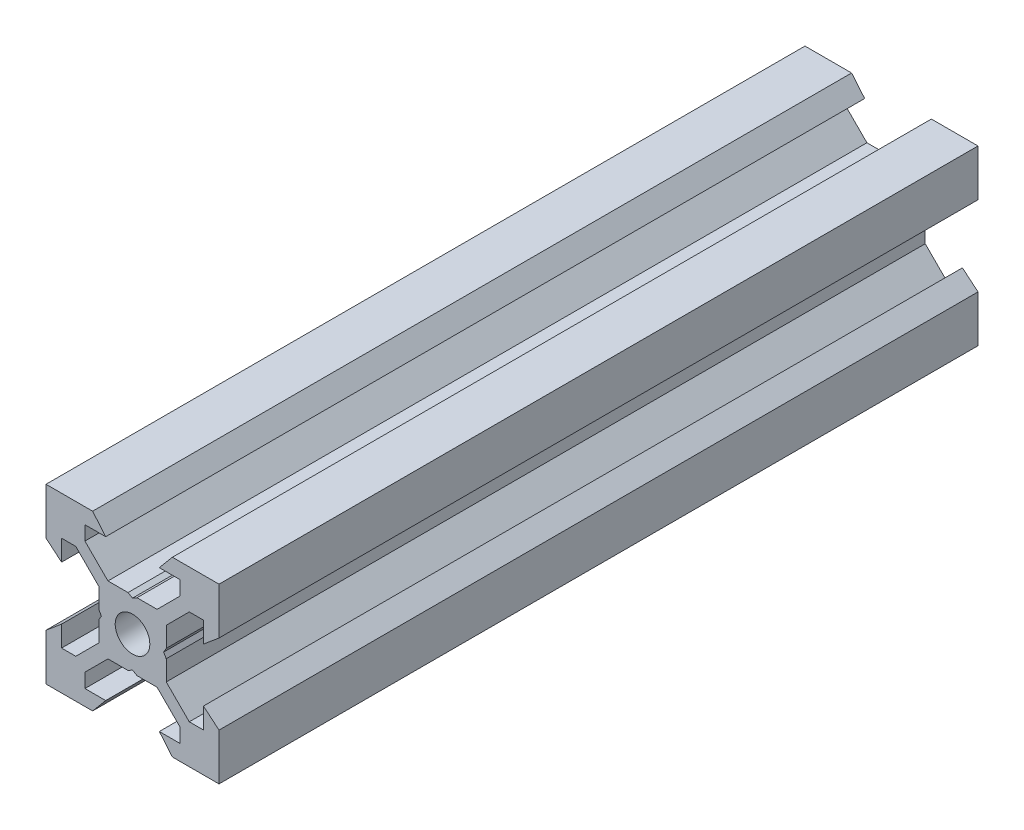
from build123d import *

# Parameters (mm, degrees)
SKETCH1_R           = 2
BOSS_EXTRUDE1_DEPTH = 43.865


with BuildPart() as part:
    # Sketch1 → Boss-Extrude1 (new, symmetric)
    with BuildSketch(Plane.XY):
        Polygon((10, 4.610379336), (10, 10), (4.610379336, 10), (3.1, 8.2), (5.5, 8.2), (5.5, 6.560660172), (2.839339828, 3.9), (0.519615242, 3.9), (0, 3.6), (-0.519615242, 3.9), (-2.839339828, 3.9), (-5.5, 6.560660172), (-5.5, 8.2), (-3.1, 8.2), (-4.610379336, 10), (-10, 10), (-10, 4.610379336), (-8.2, 3.1), (-8.2, 5.5), (-6.560660172, 5.5), (-3.9, 2.839339828), (-3.9, 0.519615242), (-3.6, 0), (-3.9, -0.519615242), (-3.9, -2.839339828), (-6.560660172, -5.5), (-8.2, -5.5), (-8.2, -3.1), (-10, -4.610379336), (-10, -10), (-4.610379336, -10), (-3.1, -8.2), (-5.5, -8.2), (-5.5, -6.560660172), (-2.839339828, -3.9), (-0.519615242, -3.9), (0, -3.6), (0.519615242, -3.9), (2.839339828, -3.9), (5.5, -6.560660172), (5.5, -8.2), (3.1, -8.2), (4.610379336, -10), (10, -10), (10, -4.610379336), (8.2, -3.1), (8.2, -5.5), (6.560660172, -5.5), (3.9, -2.839339828), (3.9, -0.519615242), (3.6, 0), (3.9, 0.519615242), (3.9, 2.839339828), (6.560660172, 5.5), (8.2, 5.5), (8.2, 3.1), align=None)
        Circle(SKETCH1_R, mode=Mode.SUBTRACT)
    extrude(amount=BOSS_EXTRUDE1_DEPTH, both=True)


solid = part.part
